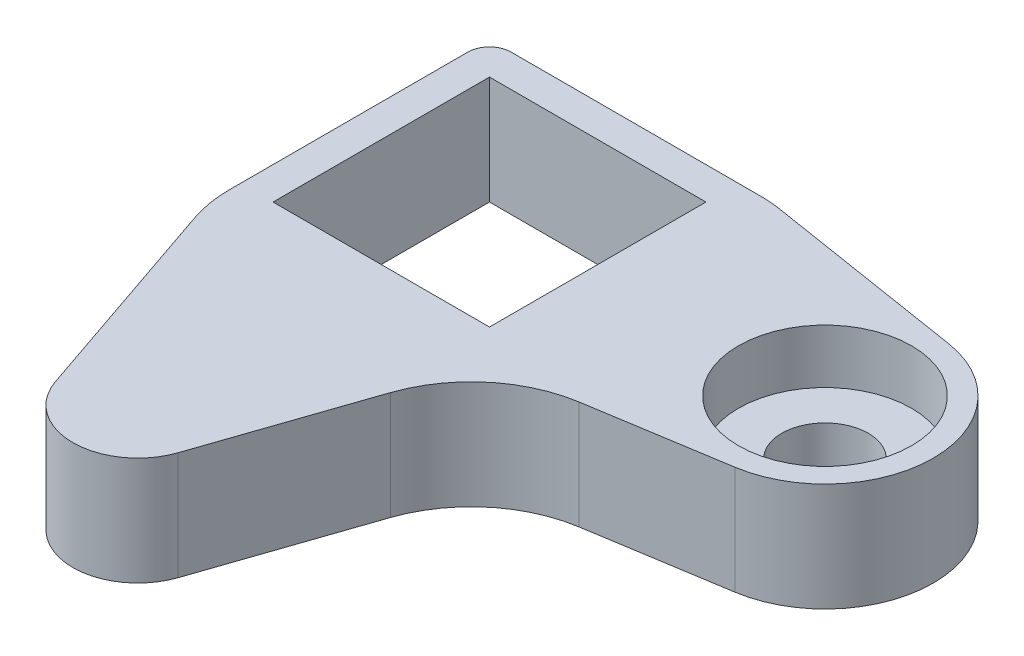
from build123d import *

# Parameters (mm, degrees)
SKETCH1_W           = 20
SKETCH1_H           = 20
BOSS_EXTRUDE1_DEPTH = 10
SKETCH2_R           = 8
CUT_EXTRUDE2_DEPTH  = 46
SKETCH3_R           = 4
CUT_EXTRUDE3_DEPTH  = 10


with BuildPart() as part:
    # Sketch1 → Boss-Extrude1 (new body)
    with BuildSketch(Plane(origin=(0, 0, 0), x_dir=(1, 0, 0), z_dir=(0, 1, 0))):
        with BuildLine():
            Line((23.939871077, 2.849965846), (42.576368333, -0.125028462))
            ThreePointArc((42.576368333, -0.125028462), (51, -10), (42.576368333, -19.874971538))
            Line((42.576368333, -19.874971538), (30.130588759, -21.86172489))
            ThreePointArc((30.130588759, -21.86172489), (24.291669579, -24.533541475), (20.666245259, -29.833341429))
            Line((20.666245259, -29.833341429), (15.677992749, -44.439174654))
            ThreePointArc((15.677992749, -44.439174654), (10, -48.5), (4.322007251, -44.439174654))
            Line((4.322007251, -44.439174654), (-2.355985499, -24.885704137))
            ThreePointArc((-2.355985499, -24.885704137), (-2.837901545, -22.973082941), (-3, -21.00735483))
            Line((-3, -21.00735483), (-3, 1))
            ThreePointArc((-3, 1), (-2.414213562, 2.414213562), (-1, 3))
            Line((-1, 3), (22.048229077, 3))
            ThreePointArc((22.048229077, 3), (22.997020375, 2.962432657), (23.939871077, 2.849965846))
        make_face()
        with Locations((10, -10)):
            Rectangle(SKETCH1_W, SKETCH1_H, mode=Mode.SUBTRACT)
    extrude(amount=BOSS_EXTRUDE1_DEPTH)

    # Sketch2 → Cut-Extrude2 (cut)
    with BuildSketch(Plane(origin=(0, 5, 0), x_dir=(1, 0, 0), z_dir=(0, 1, 0))):
        with Locations((41, -10)):
            Circle(SKETCH2_R)
    extrude(amount=CUT_EXTRUDE2_DEPTH, mode=Mode.SUBTRACT)

    # Sketch3 → Cut-Extrude3 (cut)
    with BuildSketch(Plane(origin=(0, 5, 0), x_dir=(1, 0, 0), z_dir=(0, 1, 0))):
        with Locations((10, -42.5)):
            Circle(SKETCH3_R)
        with Locations((41, -10)):
            Circle(SKETCH3_R)
    extrude(amount=-CUT_EXTRUDE3_DEPTH, mode=Mode.SUBTRACT)


solid = part.part
